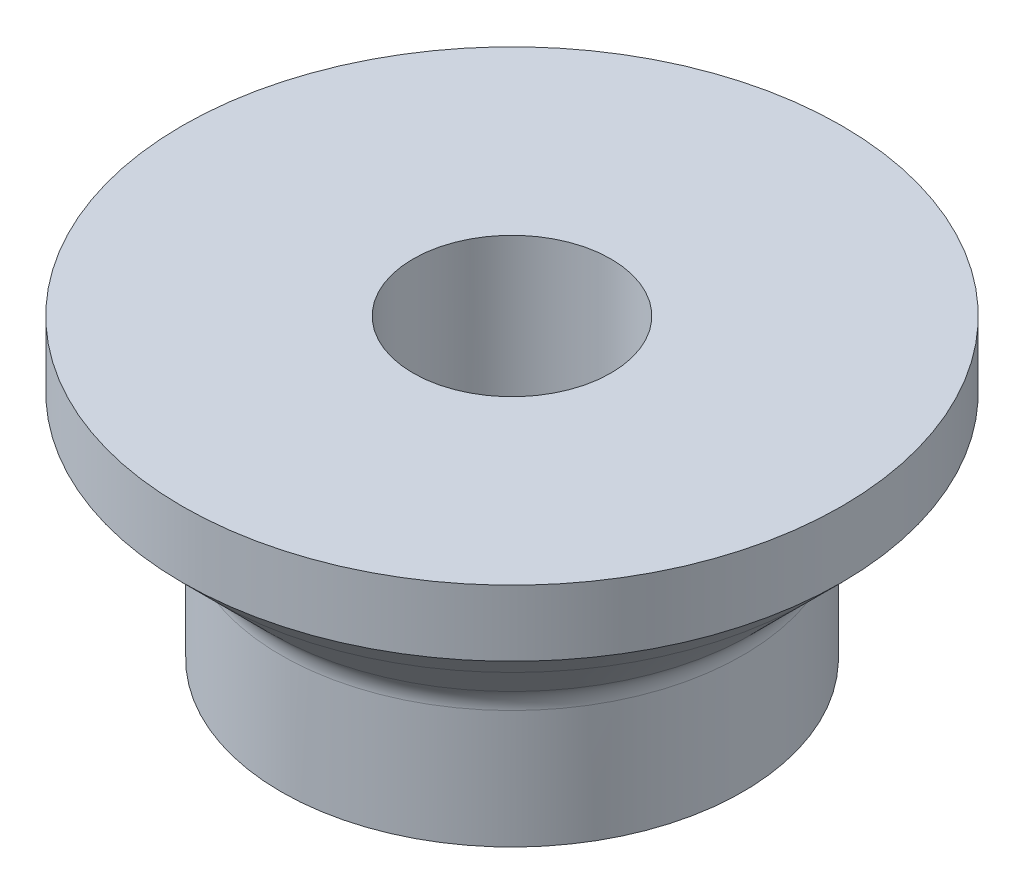
from build123d import *

# Parameters (mm, degrees)
SKETCH1_R           = 7
SKETCH1_R_2         = 3
BOSS_EXTRUDE1_DEPTH = 9
BOSS_EXTRUDE2_START = -3
SKETCH2_R           = 10
SKETCH2_R_2         = 3
BOSS_EXTRUDE2_DEPTH = 3
CUT_EXTRUDE1_DEPTH  = 3
CHAMFER1_SIZE       = 2
CHAMFER2_SIZE       = 1
FILLET1_R           = 1


with BuildPart() as part:
    # Sketch1 → Boss-Extrude1 (new body)
    with BuildSketch(Plane(origin=(0, 0, 0), x_dir=(1, 0, 0), z_dir=(0, 1, 0))):
        with Locations(Location((0, 0, 0), (0, 0, 270))):
            Circle(SKETCH1_R)
        with Locations(Location((0, 0, 0), (0, 0, 270))):
            Circle(SKETCH1_R_2, mode=Mode.SUBTRACT)
    extrude(amount=BOSS_EXTRUDE1_DEPTH)

    # Sketch2 → Boss-Extrude2 (add)
    with BuildSketch(Plane(origin=(0, 9, 0), x_dir=(1, 0, 0), z_dir=(0, 1, 0)).offset(BOSS_EXTRUDE2_START)):
        with Locations(Location((0, 0, 0), (0, 0, 270))):
            Circle(SKETCH2_R)
        with Locations(Location((0, 0, 0), (0, 0, 270))):
            Circle(SKETCH2_R_2, mode=Mode.SUBTRACT)
    extrude(amount=BOSS_EXTRUDE2_DEPTH)

    # Sketch3 → Cut-Extrude1 (cut)
    with BuildSketch(Plane.XZ):
        Polygon((-4.001709946, -2.840713087), (0.459274725, -4.885939015), (4.460984671, -2.045225929), (4.001709946, 2.840713087), (-0.459274725, 4.885939015), (-4.460984671, 2.045225929), align=None)
    extrude(amount=-CUT_EXTRUDE1_DEPTH, mode=Mode.SUBTRACT)

    # Chamfer1
    chamfer1_edges = [part.edges().sort_by_distance(p)[0] for p in [
        (0, 6, -7),
    ]]
    chamfer(chamfer1_edges, length=CHAMFER1_SIZE)

    # Chamfer2
    chamfer2_edges = [part.edges().sort_by_distance(p)[0] for p in [
        (0, 6, -10),
    ]]
    chamfer(chamfer2_edges, length=CHAMFER2_SIZE - 0.0001)  # a hair under: the kernel refuses the full size

    # Fillet1
    fillet1_edges = [part.edges().sort_by_distance(p)[0] for p in [
        (0, 4, -7),
    ]]
    fillet(fillet1_edges, radius=FILLET1_R)


solid = part.part
